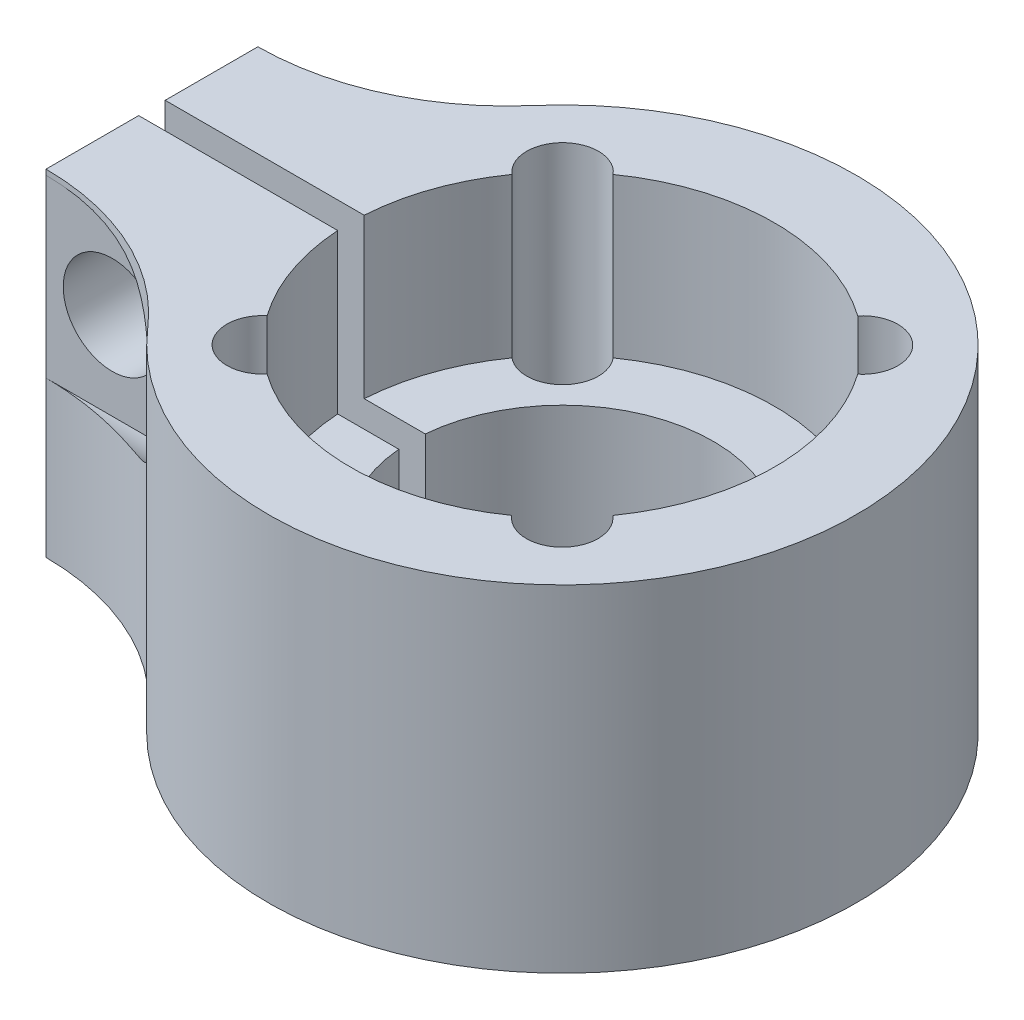
from build123d import *

# Parameters (mm, degrees)
SKETCH2_R          = 1.355
CUT_EXTRUDE1_DEPTH = 12.7
CIRPATTERN1_COUNT  = 4
SKETCH3_W          = 5.14577381
SKETCH3_H          = 8
EXTRUDE1_DEPTH     = 12.7
FILLET1_R          = 9.448
CUT_EXTRUDE2_REACH = 24.907
SKETCH4_W          = 10
SKETCH4_H          = 1
CUT_EXTRUDE3_DEPTH = 6
SKETCH6_R          = 1.85
CUT_EXTRUDE4_DEPTH = 3.5
CUT_EXTRUDE5_REACH = 22.487
SKETCH7_R          = 1.3525


with BuildPart() as part:
    # Sketch1 → Revolve1 (revolve)
    with BuildSketch(Plane.XY, mode=Mode.PRIVATE) as revolve1_sk:
        Polygon((5.7, 0), (8, 0), (8, 6), (11.1, 6), (11.1, -6.7), (5.7, -6.7), align=None)
    revolve(revolve1_sk.sketch.rotate(Axis((0, 9.388395062, 0), (0, -1, 0)), 90), axis=Axis((0, 9.388395062, 0), (0, -1, 0)))

    # Sketch2 → Cut-Extrude1 (cut)
    with BuildSketch(Plane(origin=(0, 6, 0), x_dir=(1, 0, 0), z_dir=(0, 1, 0))):
        with Locations(Location((5.66, 5.653706749, 0), (0, 0, 270))):
            Circle(SKETCH2_R)
    cut_extrude1 = extrude(amount=-CUT_EXTRUDE1_DEPTH, mode=Mode.SUBTRACT)

    # CirPattern1: Cut-Extrude1 ×4 about axis
    cirpattern1_axis = Axis((0, 0, 0), (0, 1, 0))
    for i in range(1, CIRPATTERN1_COUNT):
        add(cut_extrude1.rotate(cirpattern1_axis, i * 360 / CIRPATTERN1_COUNT), mode=Mode.SUBTRACT)

    # Sketch3 → Extrude1 (add)
    with BuildSketch(Plane(origin=(0, 6, 0), x_dir=(1, 0, 0), z_dir=(0, 1, 0))):
        with Locations((-12.927113095, 0)):
            Rectangle(SKETCH3_W, SKETCH3_H)
    extrude(amount=-EXTRUDE1_DEPTH)

    # Fillet1
    # the kernel refuses this fillet: 9.448 mm, written as the material it adds along each edge
    with BuildSketch(Plane(origin=(-10.35422619, 6, -4), x_dir=(-1, 0, 0), z_dir=(0, -1, 0))) as fillet1_piece_1_section:
        with BuildLine():
            CenterArc((5.181912326, 9.448), FILLET1_R, 220.879291984, 49.120708016)
            ThreePointArc((-1.961626544, 3.264590228), (-0.839750005, 1.717057191), (0, 0))
            Line((0, 0), (5.181912326, 0))
        make_face()
    fillet1_piece_1 = extrude(amount=12.7, mode=Mode.PRIVATE)
    fillet1_piece_1 = split(fillet1_piece_1, bisect_by=Plane(origin=(-15.5, -0.35, -4.693597662), z_dir=(1, 0, 0)), keep=Keep.TOP, mode=Mode.PRIVATE)
    add(fillet1_piece_1)
    with BuildSketch(Plane(origin=(-10.35422619, 6, 4), x_dir=(-1, 0, 0), z_dir=(0, -1, 0))) as fillet1_piece_2_section:
        with BuildLine():
            CenterArc((5.181912326, -9.448), FILLET1_R, 90, 49.120708016)
            ThreePointArc((-1.961626544, -3.264590228), (-0.839750005, -1.717057191), (0, 0))
            Line((0, 0), (5.181912326, 0))
        make_face()
    fillet1_piece_2 = extrude(amount=12.7, mode=Mode.PRIVATE)
    fillet1_piece_2 = split(fillet1_piece_2, bisect_by=Plane(origin=(-15.5, -0.35, 4.693597662), z_dir=(1, 0, 0)), keep=Keep.TOP, mode=Mode.PRIVATE)
    add(fillet1_piece_2)

    # Cut-Extrude2: up to this face of the body (flat: up to its plane)
    cut_extrude2_end = Plane(part.part.faces().sort_by_distance((-15.153532108, -6.7, 0))[0])
    # Sketch4 → Cut-Extrude2 (cut, up to the picked face)
    with BuildSketch(Plane(origin=(0, 6, 0), x_dir=(1, 0, 0), z_dir=(0, 1, 0)), mode=Mode.PRIVATE) as cut_extrude2_sk1:
        with Locations((-10.5, 0)):
            Rectangle(SKETCH4_W, SKETCH4_H)
    cut_extrude2_tool1 = split(extrude(cut_extrude2_sk1.sketch, amount=-CUT_EXTRUDE2_REACH, mode=Mode.PRIVATE), bisect_by=cut_extrude2_end, keep=Keep.BOTH, mode=Mode.PRIVATE)
    add(cut_extrude2_tool1.solids().sort_by(Axis((-10.5, 6, 0), (0, -1, 0)))[0], mode=Mode.SUBTRACT)

    # Sketch5 → Cut-Extrude3 (cut)
    with BuildSketch(Plane.ZY.offset(15.5)):
        with BuildLine():
            Line((4, 5.8), (4, -0.83286788))
            ThreePointArc((4, -0.83286788), (6.82068013, 2.48356606), (4, 5.8))
        make_face()
    extrude(amount=-CUT_EXTRUDE3_DEPTH, mode=Mode.SUBTRACT)

    # Sketch6 → Cut-Extrude4 (cut)
    with BuildSketch(Plane.XY.offset(4)):
        with Locations((-13, 2.48356606)):
            Circle(SKETCH6_R)
    extrude(amount=-CUT_EXTRUDE4_DEPTH, mode=Mode.SUBTRACT)

    # Sketch7 → Cut-Extrude5 (cut, up to next)
    with BuildSketch(Plane.XY.offset(-0.5), mode=Mode.PRIVATE) as cut_extrude5_sk1:
        with Locations((-13, 2.48356606)):
            Circle(SKETCH7_R)
    cut_extrude5_tool1 = extrude(cut_extrude5_sk1.sketch, amount=-CUT_EXTRUDE5_REACH, mode=Mode.PRIVATE) & part.part
    add(cut_extrude5_tool1.solids().sort_by_distance((-13, 2.483566, -0.5))[0], mode=Mode.SUBTRACT)


solid = part.part
